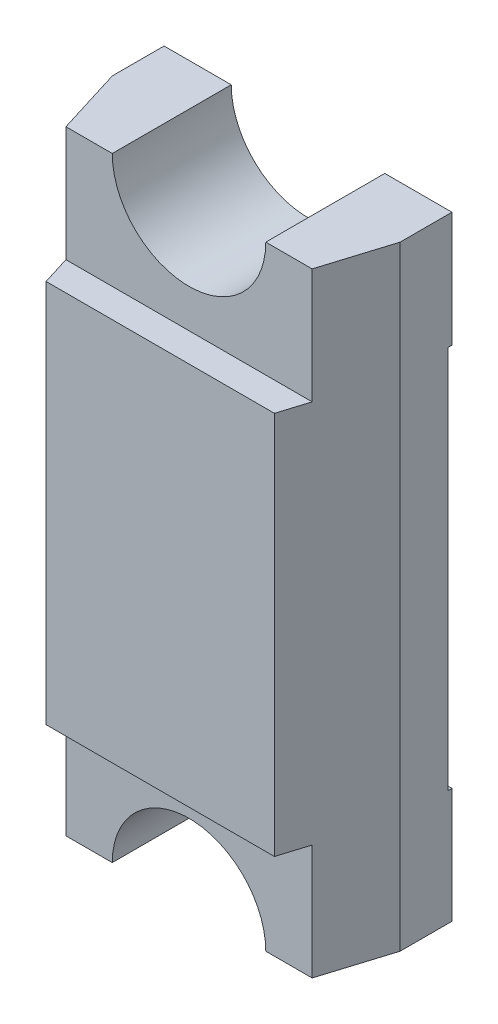
from build123d import *

# Parameters (mm, degrees)
EXTRUDE_1_DEPTH     = 0.75
CUT_EXTRUDE_1_REACH = 4.318
SKETCH_2_W          = 0.15
SKETCH_2_H          = 0.667874604
WRAP_1_DEPTH        = 0.01
CUT_EXTRUDE_2_DEPTH = 5
EXTRUDE_START       = 0.02
EXTRUDE_2_DEPTH     = 0.02


# Read off the part's stored shape, not the designer's step: 包覆1
with BuildPart() as part:
    # 草图1 → 凸台-拉伸1 (new body)
    with BuildSketch(Plane.XY):
        with BuildLine():
            Line((-0.75, 1.6), (-0.4, 1.6))
            ThreePointArc((-0.4, 1.6), (0, 1.2), (0.4, 1.6))
            Line((0.4, 1.6), (0.75, 1.6))
            Line((0.75, 1.6), (0.75, -1.6))
            Line((0.75, -1.6), (0.4, -1.6))
            ThreePointArc((0.4, -1.6), (0, -1.2), (-0.4, -1.6))
            Line((-0.4, -1.6), (-0.75, -1.6))
            Line((-0.75, -1.6), (-0.75, 1.6))
        make_face()
    extrude(amount=EXTRUDE_1_DEPTH)

    # 草图2 → 切除-拉伸1 (cut, up to next)
    with BuildSketch(Plane(origin=(0.75, 0, 0), x_dir=(0, 0, -1), z_dir=(1, 0, 0)), mode=Mode.PRIVATE) as cut_extrude_1_sk1:
        with Locations((-0.675, 1.333937302)):
            Rectangle(SKETCH_2_W, SKETCH_2_H)
    cut_extrude_1_tool1 = extrude(cut_extrude_1_sk1.sketch, amount=-CUT_EXTRUDE_1_REACH, mode=Mode.PRIVATE) & part.part
    # 草图2 → 切除-拉伸1 (cut, up to next)
    with BuildSketch(Plane(origin=(0.75, 0, 0), x_dir=(0, 0, -1), z_dir=(1, 0, 0)), mode=Mode.PRIVATE) as cut_extrude_1_sk2:
        with Locations((-0.675, -1.333937302)):
            Rectangle(SKETCH_2_W, SKETCH_2_H)
    cut_extrude_1_tool2 = extrude(cut_extrude_1_sk2.sketch, amount=-CUT_EXTRUDE_1_REACH, mode=Mode.PRIVATE) & part.part
    add(cut_extrude_1_tool1.solids().sort_by_distance((0.75, 1.333937, 0.675))[0], mode=Mode.SUBTRACT)
    add(cut_extrude_1_tool2.solids().sort_by_distance((0.75, -1.333937, 0.675))[0], mode=Mode.SUBTRACT)

    # 包覆1 outline → 包覆1 (add)
    with BuildSketch(Plane(origin=(0, 0, 0), x_dir=(-1, 0, 0), z_dir=(0, 0, -1))):
        Polygon((0.041666667, 0.013888889), (0.041666667, 0.458333333), (0.416666667, 0.458333333), (0.416666667, 0.513888889), (-0.548611111, 0.513888889), (-0.548611111, 0.458333333), (-0.173611111, 0.458333333), (-0.173611111, 0.013888889), align=None)
    extrude(amount=WRAP_1_DEPTH)

    # 草图7 → 切除-拉伸2 (cut, symmetric)
    with BuildSketch(Plane(origin=(0, 0.625, 0), x_dir=(1, 0, 0), z_dir=(0, 1, 0))):
        Polygon((-0.75, -0.25), (-0.595016124, -0.75), (-0.75, -0.75), align=None)
        Polygon((0.595016124, -0.75), (0.75, -0.75), (0.75, -0.25), align=None)
    extrude(amount=CUT_EXTRUDE_2_DEPTH, both=True, mode=Mode.SUBTRACT)

    # 草图8 → 凸台-拉伸2 (add)
    with BuildSketch(Plane(origin=(0, 0, 0), x_dir=(-1, 0, 0), z_dir=(0, 0, -1)).offset(EXTRUDE_START)):
        with BuildLine():
            Line((-0.75, 1), (0.75, 1))
            Line((0.75, 1), (0.75, 1.6))
            Line((0.75, 1.6), (0.4, 1.6))
            ThreePointArc((0.4, 1.6), (0, 1.2), (-0.4, 1.6))
            Line((-0.4, 1.6), (-0.75, 1.6))
            Line((-0.75, 1.6), (-0.75, 1))
        make_face()
        with BuildLine():
            Line((-0.75, -1), (0.75, -1))
            Line((0.75, -1), (0.75, -1.6))
            Line((0.75, -1.6), (0.4, -1.6))
            ThreePointArc((0.4, -1.6), (0, -1.2), (-0.4, -1.6))
            Line((-0.4, -1.6), (-0.75, -1.6))
            Line((-0.75, -1.6), (-0.75, -1))
        make_face()
    extrude(amount=-EXTRUDE_2_DEPTH)


solid = part.part
